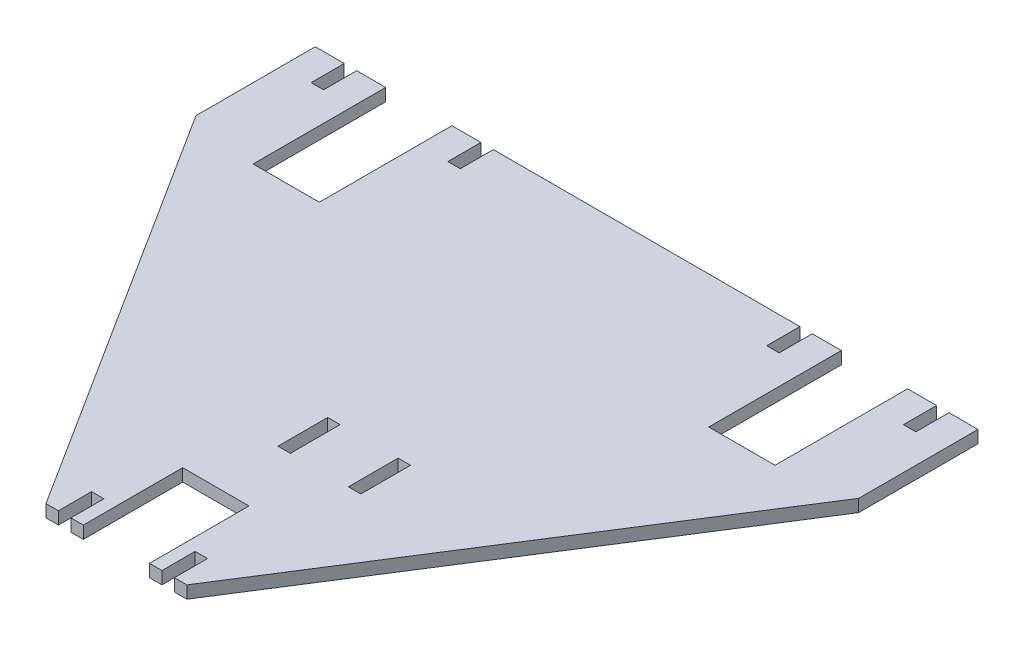
from build123d import *

# Parameters (mm, degrees)
BOSS_EXTRUDE1_DEPTH = 4.7625
SKETCH2_W           = 4.7625
SKETCH2_H           = 19.05
CUT_EXTRUDE1_DEPTH  = 163.709069834


with BuildPart() as part:
    # Sketch1 → Boss-Extrude1 (new body)
    with BuildSketch(Plane(origin=(0, 0, 0), x_dir=(1, 0, 0), z_dir=(0, 1, 0))):
        Polygon((12.7, -63.5), (-12.7, -63.5), (-12.7, -101.6), (-17.4625, -101.6), (-17.4625, -88.9), (-22.225, -88.9), (-22.225, -101.6), (-26.9875, -101.6), (-127, 55.88), (-127, 101.6), (-115.8875, 101.6), (-115.8875, 88.9), (-111.125, 88.9), (-111.125, 101.6), (-100.0125, 101.6), (-100.0125, 50.8), (-74.6125, 50.8), (-74.6125, 101.6), (-63.5, 101.6), (-63.5, 88.9), (-58.7375, 88.9), (-58.7375, 101.6), (58.7375, 101.6), (58.7375, 88.9), (63.5, 88.9), (63.5, 101.6), (74.6125, 101.6), (74.6125, 50.8), (100.0125, 50.8), (100.0125, 101.6), (111.125, 101.6), (111.125, 88.9), (115.8875, 88.9), (115.8875, 101.6), (127, 101.6), (127, 55.88), (26.9875, -101.6), (22.225, -101.6), (22.225, -88.9), (17.4625, -88.9), (17.4625, -101.6), (12.7, -101.6), align=None)
    extrude(amount=BOSS_EXTRUDE1_DEPTH)

    # Sketch2 → Cut-Extrude1 (cut, through all)
    with BuildSketch(Plane(origin=(0, 4.7625, 0), x_dir=(1, 0, 0), z_dir=(0, 1, 0))):
        with Locations((0.79375, -28.575)):
            Rectangle(SKETCH2_W, SKETCH2_H)
        with Locations((27.78125, -28.575)):
            Rectangle(SKETCH2_W, SKETCH2_H)
    extrude(amount=-CUT_EXTRUDE1_DEPTH, mode=Mode.SUBTRACT)


solid = part.part
